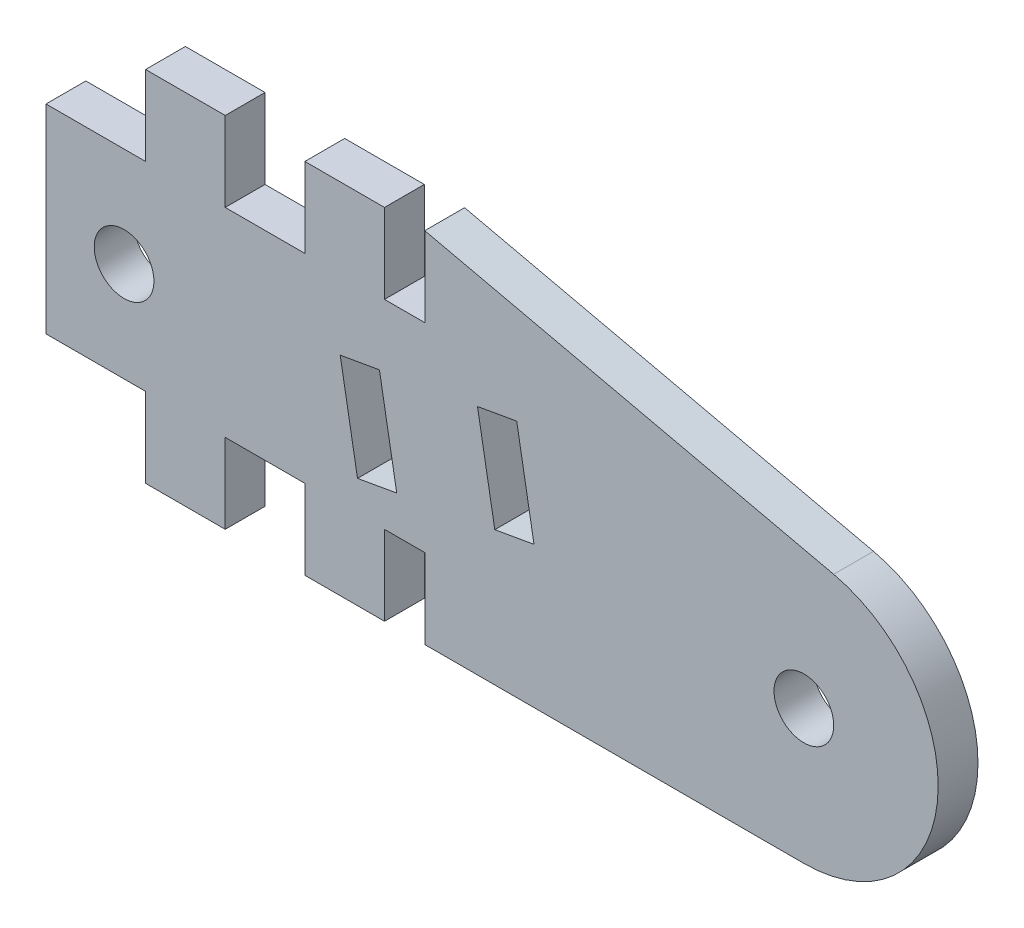
from build123d import *

# Parameters (mm, degrees)
SKETCH1_R           = 1.5
BOSS_EXTRUDE1_DEPTH = 2


with BuildPart() as part:
    # Sketch1 → Boss-Extrude1 (new body)
    with BuildSketch(Plane.XY):
        with BuildLine():
            Line((5, 0), (9, 0))
            Line((9, 0), (9, 4))
            Line((9, 4), (13, 4))
            Line((13, 4), (13, 0))
            Line((13, 0), (17, 0))
            Line((17, 0), (17, 4))
            Line((17, 4), (19.021561934, 4))
            Line((19.021561934, 4), (19.021561934, 0))
            Line((19.021561934, 0), (38.059495851, 0))
            ThreePointArc((38.059495851, 0), (44.762590659, 5.991570372), (39.557599026, 13.322222296))
            Line((39.557599026, 13.322222296), (19.021561934, 17.999988357))
            Line((19.021561934, 17.999988357), (19.021561934, 13.999988357))
            Line((19.021561934, 13.999988357), (17, 13.999988357))
            Line((17, 13.999988357), (17, 17.999988357))
            Line((17, 17.999988357), (13, 17.999988357))
            Line((13, 17.999988357), (13, 13.999988357))
            Line((13, 13.999988357), (9, 13.999988357))
            Line((9, 13.999988357), (9, 17.999988357))
            Line((9, 17.999988357), (5, 17.999988357))
            Line((5, 17.999988357), (5, 13.999988357))
            Line((5, 13.999988357), (0, 13.999988357))
            Line((0, 13.999988357), (0, 4))
            Line((0, 4), (5, 4))
            Line((5, 4), (5, 0))
        make_face()
        with Locations((3.920490093, 9)):
            Circle(SKETCH1_R, mode=Mode.SUBTRACT)
        with Locations((38.059495851, 6.745343083)):
            Circle(SKETCH1_R, mode=Mode.SUBTRACT)
        Polygon((23.639149333, 12.024852982), (21.669533827, 11.677556626), (22.537774715, 6.753517861), (24.507390221, 7.100814216), align=None, mode=Mode.SUBTRACT)
        Polygon((16.745495062, 10.809315738), (17.61373595, 5.885276973), (15.644120444, 5.537980617), (14.775879556, 10.462019383), align=None, mode=Mode.SUBTRACT)
    extrude(amount=BOSS_EXTRUDE1_DEPTH)


solid = part.part
